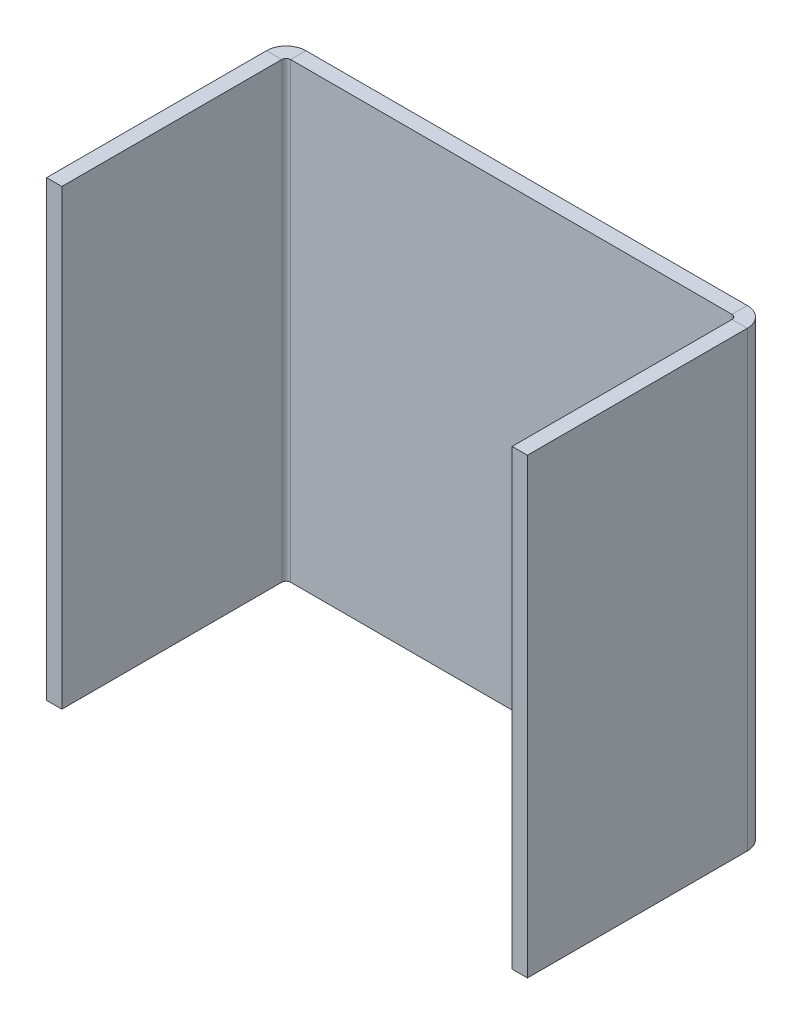
from build123d import *

# Parameters (mm, degrees)
SKETCH1_W              = 152.672175124
SKETCH1_H              = 75.20671235
BASE_FLANGE1_DEPTH     = 2.54
SKETCHED_START         = -37.603356175
SKETCHED_BEND1_DEPTH   = 75.20671235
SKETCHED_BEND1_2_DEPTH = 75.20671235


# Read off the part's stored shape, not the designer's step: Sketched Bend1
# Sheet-metal steps are written as plain solids
with BuildPart() as part:
    # Sketch1 → Base-Flange1 (new body)
    with BuildSketch(Plane.XY):
        Rectangle(SKETCH1_W, SKETCH1_H)
    extrude(amount=-BASE_FLANGE1_DEPTH)

    # Sketched Bend1 outline → Sketched Bend1 (cut)
    with BuildSketch(Plane(origin=(0, 0, 0), x_dir=(1, 0, 0), z_dir=(0, 1, 0)).offset(SKETCHED_START)):
        with BuildLine():
            ThreePointArc((-39.8528381, 0), (-38.700029664, 1.827542266), (-36.660107607, 2.54))
            Line((-36.660107607, 2.54), (-76.336087562, 2.54))
            Line((-76.336087562, 2.54), (-76.336087562, 0))
            Line((-76.336087562, 0), (-39.8528381, 0))
        make_face()
        with BuildLine():
            Line((76.336087562, 2.54), (36.660107607, 2.54))
            ThreePointArc((36.660107607, 2.54), (38.700029664, 1.827542266), (39.8528381, 0))
            Line((39.8528381, 0), (76.336087562, 0))
            Line((76.336087562, 0), (76.336087562, 2.54))
        make_face()
    extrude(amount=SKETCHED_BEND1_DEPTH, mode=Mode.SUBTRACT)

    # Sketched Bend1 2 outline → Sketched Bend1 2 (add)
    with BuildSketch(Plane(origin=(0, 0, 0), x_dir=(1, 0, 0), z_dir=(0, 1, 0)).offset(SKETCHED_START)):
        with BuildLine():
            Line((-36.660107607, 0), (-39.8528381, 0))
            ThreePointArc((-39.8528381, 0), (-39.915672711, -0.365920336), (-39.936707607, -0.7366))
            Line((-39.936707607, -0.7366), (-39.936707607, -37.260620045))
            Line((-39.936707607, -37.260620045), (-37.396707607, -37.260620045))
            Line((-37.396707607, -37.260620045), (-37.396707607, -0.7366))
            ThreePointArc((-37.396707607, -0.7366), (-37.180962462, -0.215745145), (-36.660107607, 0))
        make_face()
        with BuildLine():
            ThreePointArc((39.936707607, -0.7366), (39.915672711, -0.365920336), (39.8528381, 0))
            Line((39.8528381, 0), (36.660107607, 0))
            ThreePointArc((36.660107607, 0), (37.180962462, -0.215745145), (37.396707607, -0.7366))
            Line((37.396707607, -0.7366), (37.396707607, -37.260620045))
            Line((37.396707607, -37.260620045), (39.936707607, -37.260620045))
            Line((39.936707607, -37.260620045), (39.936707607, -0.7366))
        make_face()
    extrude(amount=SKETCHED_BEND1_2_DEPTH)


solid = part.part
